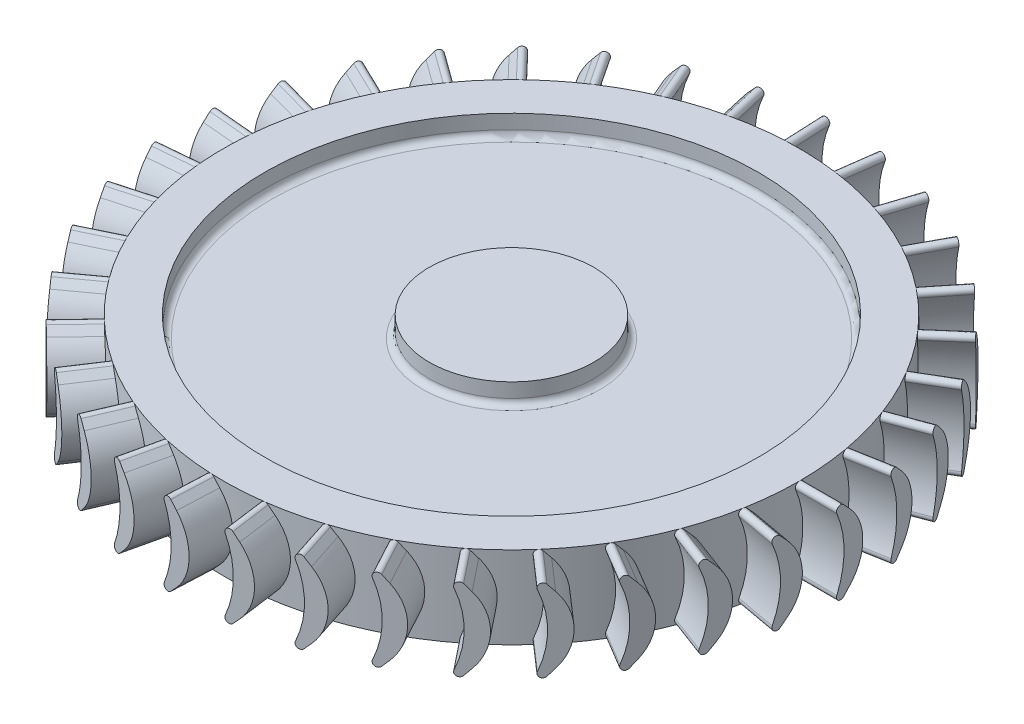
from build123d import *

# Parameters (mm, degrees)
FILLET2_R           = 0.762
BOSS_EXTRUDE1_START = -2.54
BOSS_EXTRUDE1_DEPTH = 7.54
CIRPATTERN1_COUNT   = 35


with BuildPart() as part:
    # Sketch1 → Revolve1 (revolve)
    with BuildSketch(Plane.XY):
        Polygon((0, 0), (0, 10), (10, 10), (10, 7.5), (30, 7.5), (30, 10), (35, 10), (35, 0), (30, 0), (30, 2.5), (10, 2.5), (10, 0), align=None)
    revolve(axis=Axis((0, 0, 0), (0, 1, 0)))

    # Fillet2
    fillet2_edges = [part.edges().sort_by_distance(p)[0] for p in [
        (-10, 7.5, 0),
        (-30, 7.5, 0),
        (-10, 2.5, 0),
        (-30, 2.5, 0),
    ]]
    fillet(fillet2_edges, radius=FILLET2_R)

    # Sketch2 → Boss-Extrude1 (add)
    with BuildSketch(Plane(origin=(35, 0, 0), x_dir=(0, 0, -1), z_dir=(1, 0, 0)).offset(BOSS_EXTRUDE1_START)):
        with BuildLine():
            Line((0.365676851, 9.84099918), (1.104287453, 9.048936282))
            ThreePointArc((1.104287453, 9.048936282), (2.699205869, 5), (1.104287453, 0.951063718))
            Line((1.104287453, 0.951063718), (0.365676851, 0.15900082))
            ThreePointArc((0.365676851, 0.15900082), (-0.272319518, 0.080664716), (-0.460252427, 0.695365564))
            ThreePointArc((-0.460252427, 0.695365564), (0.415535347, 5), (-0.460252427, 9.304634436))
            ThreePointArc((-0.460252427, 9.304634436), (-0.272319518, 9.919335284), (0.365676851, 9.84099918))
        make_face()
    boss_extrude1 = extrude(amount=BOSS_EXTRUDE1_DEPTH)

    # CirPattern1: Boss-Extrude1 ×35 about axis
    cirpattern1_axis = Axis((0, 10, 0), (0, 1, 0))
    for i in range(1, CIRPATTERN1_COUNT):
        add(boss_extrude1.rotate(cirpattern1_axis, i * 360 / CIRPATTERN1_COUNT))


solid = part.part
